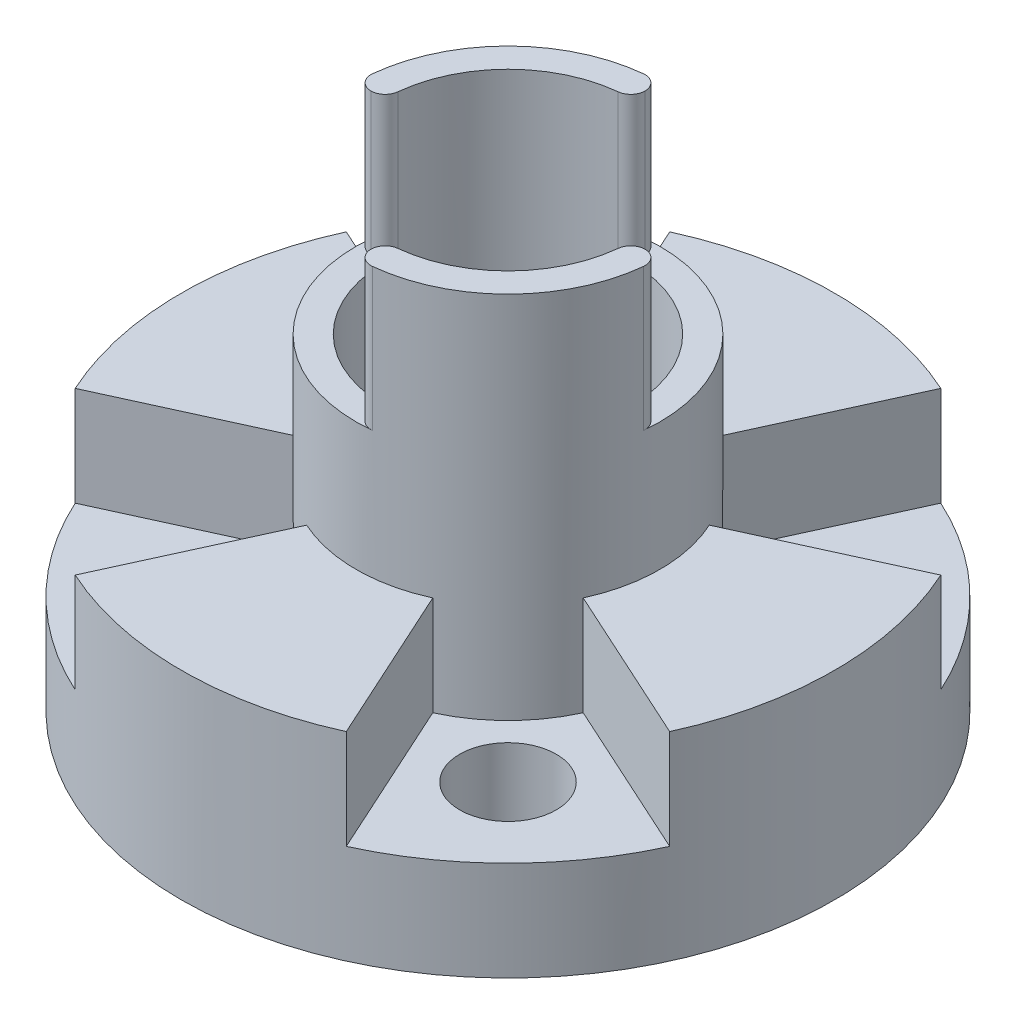
from build123d import *

# Parameters (mm, degrees)
CROQUIS1_R              = 11.5
CROQUIS1_R_2            = 4.35
CROQUIS1_R_3            = 1.7000000000000004
SALIENTE_EXTRUIR1_DEPTH = 3.5
CROQUIS2_R              = 5.35
CROQUIS2_R_2            = 4.35
SALIENTE_EXTRUIR2_DEPTH = 13
CORTAR_EXTRUIR1_START   = -5
CORTAR_EXTRUIR1_DEPTH   = 5
CROQUIS4_R              = 5.275
CROQUIS4_R_2            = 4.35
CORTAR_EXTRUIR2_DEPTH   = 2
REDONDEO1_R             = 0.6
REDONDEO2_R             = 0.5
SALIENTE_EXTRUIR3_DEPTH = 3.5


with BuildPart() as part:
    # Croquis1 → Saliente-Extruir1 (new body)
    with BuildSketch(Plane(origin=(0, 0, 0), x_dir=(1, 0, 0), z_dir=(0, 1, 0))):
        with Locations(Location((1.731948e-11, 0, 0), (0, 0, 270))):
            Circle(CROQUIS1_R)
        with Locations(Location((1.731948e-11, 0, 0), (0, 0, 270))):
            Circle(CROQUIS1_R_2, mode=Mode.SUBTRACT)
        with Locations(Location((5.656854249492441, 5.65685424949238, 0), (0, 0, 270))):
            Circle(CROQUIS1_R_3, mode=Mode.SUBTRACT)
        with Locations(Location((-5.656854249492318, 5.656854249492381, 0), (0, 0, 270))):
            Circle(CROQUIS1_R_3, mode=Mode.SUBTRACT)
        with Locations(Location((-5.656854249492318, -5.656854249492381, 0), (0, 0, 270))):
            Circle(CROQUIS1_R_3, mode=Mode.SUBTRACT)
        with Locations(Location((5.656854249492441, -5.65685424949238, 0), (0, 0, 270))):
            Circle(CROQUIS1_R_3, mode=Mode.SUBTRACT)
    extrude(amount=SALIENTE_EXTRUIR1_DEPTH)

    # Croquis2 → Saliente-Extruir2 (add)
    with BuildSketch(Plane(origin=(0, 3.5, 0), x_dir=(1, 0, 0), z_dir=(0, 1, 0))):
        with Locations(Location((1.731948e-11, 0, 0), (0, 0, 90))):
            Circle(CROQUIS2_R)
        with Locations(Location((1.731948e-11, 0, 0), (0, 0, 270))):
            Circle(CROQUIS2_R_2, mode=Mode.SUBTRACT)
    extrude(amount=SALIENTE_EXTRUIR2_DEPTH)

    # Croquis3 → Cortar-Extruir1 (cut)
    with BuildSketch(Plane(origin=(0, 16.5, 0), x_dir=(1, 0, 0), z_dir=(0, 1, 0)).offset(CORTAR_EXTRUIR1_START)):
        with BuildLine():
            Line((1.732086e-11, 5.35), (1.732072e-11, 4.35))
            ThreePointArc((1.732072e-11, 4.35), (3.0759144981543076, 3.0759144981369877), (4.34999999998268, 0))
            Line((4.34999999998268, 0), (5.34999999998268, 0))
            ThreePointArc((5.34999999998268, 0), (3.783021279340855, 3.783021279323535), (1.732086e-11, 5.35))
        make_face()
        with BuildLine():
            Line((1.732086e-11, -5.35), (1.732072e-11, -4.35))
            ThreePointArc((1.732072e-11, -4.35), (-3.075914498144163, -3.075914498161481), (-4.34999999998268, 0))
            Line((-4.34999999998268, 0), (-5.34999999998268, 0))
            ThreePointArc((-5.34999999998268, 0), (-3.7830212793307103, -3.7830212793480285), (1.732086e-11, -5.35))
        make_face()
    extrude(amount=CORTAR_EXTRUIR1_DEPTH, mode=Mode.SUBTRACT)

    # Croquis4 → Cortar-Extruir2 (cut)
    with BuildSketch(Plane.XZ):
        with Locations(Location((1.731948e-11, 0, 0), (0, 0, 270))):
            Circle(CROQUIS4_R)
        with Locations(Location((1.731948e-11, 0, 0), (0, 0, 270))):
            Circle(CROQUIS4_R_2, mode=Mode.SUBTRACT)
    extrude(amount=-CORTAR_EXTRUIR2_DEPTH, mode=Mode.SUBTRACT)

    # Redondeo1
    redondeo1_edges = [part.edges().sort_by_distance(p)[0] for p in [
        (1.732109e-11, 0, 5.275),
    ]]
    fillet(redondeo1_edges, radius=REDONDEO1_R)

    # Redondeo2
    # the kernel refuses this fillet: 0.5 mm, written as the material it takes off along each edge
    with BuildSketch(Plane(origin=(-4.34999999998268, 11.5, -2.1e-16), x_dir=(0.05161519234821224, 0, -0.9986670475783493), z_dir=(0, 1, 0))) as redondeo2_piece_1:
        with BuildLine():
            CenterArc((0.4748597696035476, 0.49933352378917434), REDONDEO2_R, 182.9586473758917, 84.08270524821648)
            Line((-0.02447375418562714, 0.4735259276150691), (0, 0))
            ThreePointArc((0, 0), (0.22452608671472166, 0.00579834303418057), (0.44905217342944187, 0))
        make_face()
    extrude(amount=6.185394894032285, mode=Mode.SUBTRACT)
    with BuildSketch(Plane(origin=(-5.34999999998268, 11.5, 0), x_dir=(1, 0, 0), z_dir=(0, 1, 0))) as redondeo2_piece_2:
        with BuildLine():
            CenterArc((0.5258420423870858, 0.5), REDONDEO2_R, 174.0827052482164, 95.91729475178363)
            ThreePointArc((0.02850617046822901, 0.5515463917525775), (0.00713129545583069, 0.2761412790629337), (0, 0))
            Line((0, 0), (0.5258420423870858, 0))
        make_face()
    extrude(amount=6.380706395314668, mode=Mode.SUBTRACT)
    with BuildSketch(Plane(origin=(1.7321e-11, 11.5, 5.35), x_dir=(-3.5e-16, 0, -1), z_dir=(0, 1, 0))) as redondeo2_piece_3:
        with BuildLine():
            CenterArc((0.5258420423870855, -0.5), REDONDEO2_R, 89.99999999999997, 95.91729475178352)
            ThreePointArc((0.02850617046822881, -0.5515463917525766), (0.00713129545583059, -0.27614127906293173), (0, 0))
            Line((0, 0), (0.5258420423870858, 0))
        make_face()
    extrude(amount=6.3807063953146645, mode=Mode.SUBTRACT)
    with BuildSketch(Plane(origin=(1.731868e-11, 11.5, 4.35), x_dir=(0.9986670475783493, 0, -0.051615192348211894), z_dir=(0, 1, 0))) as redondeo2_piece_4:
        with BuildLine():
            CenterArc((0.474859769603551, -0.49933352378917434), REDONDEO2_R, 92.95864737589183, 84.08270524821639)
            Line((-0.0244737541856237, -0.4735259276150684), (0, 0))
            ThreePointArc((0, 0), (0.2245260867147224, -0.00579834303418053), (0.4490521734294448, 0))
        make_face()
    extrude(amount=6.185394894032285, mode=Mode.SUBTRACT)
    with BuildSketch(Plane(origin=(1.732072e-11, 11.5, -4.35), x_dir=(-0.9986670475783493, 0, 0.05161519234821218), z_dir=(0, 1, 0))) as redondeo2_piece_5:
        with BuildLine():
            CenterArc((0.474859769603548, -0.49933352378917434), REDONDEO2_R, 92.95864737589177, 84.08270524821641)
            Line((-0.02447375418562666, -0.47352592761506823), (0, 0))
            ThreePointArc((0, 0), (0.22452608671472019, -0.00579834303418048), (0.4490521734294423, 0))
        make_face()
    extrude(amount=6.185394894032285, mode=Mode.SUBTRACT)
    with BuildSketch(Plane(origin=(1.731981e-11, 11.5, -5.35), x_dir=(1.91e-15, 0, 1), z_dir=(0, 1, 0))) as redondeo2_piece_6:
        with BuildLine():
            CenterArc((0.5258420423870848, -0.5), REDONDEO2_R, 89.99999999999989, 95.91729475178357)
            ThreePointArc((0.02850617046822795, -0.5515463917525762), (0.00713129545583016, -0.2761412790629328), (0, 0))
            Line((0, 0), (0.5258420423870858, 0))
        make_face()
    extrude(amount=6.3807063953146645, mode=Mode.SUBTRACT)
    with BuildSketch(Plane(origin=(4.34999999998268, 11.5, 1.9e-16), x_dir=(-0.05161519227127975, 0, 0.9986670475823255), z_dir=(0, 1, 0))) as redondeo2_piece_7:
        with BuildLine():
            CenterArc((0.47485976964022647, 0.4993335237871862), REDONDEO2_R, 182.95864737147792, 84.08270524821648)
            Line((-0.02447375415093636, 0.4735259276515472), (0, 0))
            ThreePointArc((0, 0), (0.22452608671427532, 0.00579834305147695), (0.44905217342765447, 0))
        make_face()
    extrude(amount=6.1853948941188825, mode=Mode.SUBTRACT)
    with BuildSketch(Plane(origin=(5.34999999998268, 11.5, 0), x_dir=(-1, 0, 0), z_dir=(0, 1, 0))) as redondeo2_piece_8:
        with BuildLine():
            CenterArc((0.5258420423524468, 0.5), REDONDEO2_R, 174.08270524821663, 95.9172947517834)
            ThreePointArc((0.02850617043358916, 0.5515463917525757), (0.00713129542123792, 0.2761412790638253), (0, 0))
            Line((0, 0), (0.5258420423524468, 0))
        make_face()
    extrude(amount=6.380706395310192, mode=Mode.SUBTRACT)

    # Croquis5 → Saliente-Extruir3 (add)
    with BuildSketch(Plane(origin=(0, 3.5, 0), x_dir=(1, 0, 0), z_dir=(0, 1, 0))):
        with BuildLine():
            Line((-4.867801495370659, 2.219686599837588), (-10.46349854147086, 4.7712889529219185))
            ThreePointArc((-10.46349854147086, 4.7712889529219185), (-11.49999999998268, 1.41e-15), (-10.46349854147086, -4.771288952921916))
            Line((-10.46349854147086, -4.771288952921914), (-4.86780149537066, -2.219686599837586))
            ThreePointArc((-4.86780149537066, -2.219686599837586), (-5.34999999998268, 8.9e-16), (-4.86780149537066, 2.219686599837588))
        make_face()
        with BuildLine():
            Line((-2.2196865998351183, -4.867801495381207), (-4.77128895293652, -10.463498541473625))
            ThreePointArc((-4.771288952936522, -10.463498541473623), (-6.77758e-12, -11.5), (4.771288952927311, -10.463498541493617))
            Line((4.771288952927309, -10.46349854149362), (2.2196865998493576, -4.86780149539051))
            ThreePointArc((2.219686599849358, -4.867801495390509), (6.10956e-12, -5.35), (-2.219686599835118, -4.867801495381206))
        make_face()
        with BuildLine():
            ThreePointArc((11.50000000001732, 0), (11.237887551221265, 2.4412872396535783), (10.463498541496383, 4.771288952941911))
            Line((10.463498541496381, 4.7712889529419105), (4.867801495401058, 2.2196865998468893))
            ThreePointArc((4.867801495401059, 2.2196865998468898), (5.228060730360026, 1.1357292810562294), (5.350000000017321, -1.1e-16))
            ThreePointArc((5.350000000017321, -1.1e-16), (5.228060730360026, -1.1357292810562303), (4.867801495401057, -2.2196865998468898))
            Line((4.867801495401058, -2.2196865998468898), (10.463498541496381, -4.771288952941912))
            ThreePointArc((10.463498541496378, -4.7712889529419185), (11.237887551221265, -2.4412872396535787), (11.50000000001732, -2.82e-15))
        make_face()
        with BuildLine():
            ThreePointArc((4.771288952927309, 10.46349854149362), (-6.77732e-12, 11.5), (-4.771288952936519, 10.463498541473625))
            Line((-4.771288952936519, 10.463498541473623), (-2.2196865998351187, 4.867801495381207))
            ThreePointArc((-2.219686599835118, 4.867801495381207), (6.10867e-12, 5.35), (2.219686599849357, 4.86780149539051))
            Line((2.2196865998493576, 4.86780149539051), (4.771288952927309, 10.46349854149362))
        make_face()
    extrude(amount=SALIENTE_EXTRUIR3_DEPTH)


solid = part.part
